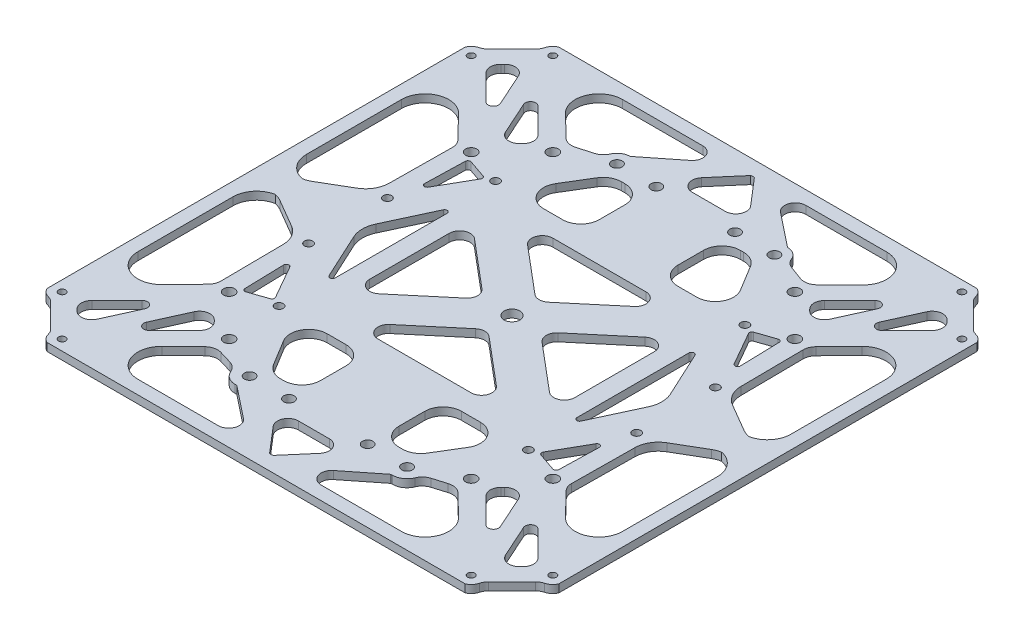
from build123d import *

# Parameters (mm, degrees)
SKETCH2_W               = 195
SKETCH2_H               = 195
BOSS_EXTRUDE1_DEPTH     = 3
CUT_EXTRUDE1_DEPTH      = 138.918454168
CUT_EXTRUDE1_DEPTH_BACK = 138.918454168
SKETCH3_R               = 1.6
CUT_EXTRUDE2_DEPTH      = 138.918454168
CUT_EXTRUDE2_DEPTH_BACK = 138.918454168
SKETCH4_R               = 2.11
SKETCH4_R_2             = 1.35
CUT_EXTRUDE3_DEPTH      = 138.918454168
CUT_EXTRUDE3_DEPTH_BACK = 138.918454168
SKETCH5_R               = 2
CUT_EXTRUDE4_DEPTH      = 138.918454168
CUT_EXTRUDE4_DEPTH_BACK = 138.918454168
SKETCH6_R               = 1.6
CUT_EXTRUDE5_DEPTH      = 138.918454168
CUT_EXTRUDE5_DEPTH_BACK = 138.918454168
CUT_EXTRUDE7_DEPTH      = 138.918454168
CUT_EXTRUDE7_DEPTH_BACK = 138.918454168
SKETCH8_R               = 3
SKETCH9_W               = 5.16198808
SKETCH9_H               = 152.468237428
BOSS_EXTRUDE2_DEPTH     = 3
FILLET1_R               = 9
BOSS_EXTRUDE3_DEPTH     = 3
FILLET2_R               = 9
FILLET3_R               = 4
BOSS_EXTRUDE4_DEPTH     = 3


with BuildPart() as part:
    # Sketch2 → Boss-Extrude1 (new body)
    with BuildSketch(Plane(origin=(0, 0, 0), x_dir=(1, 0, 0), z_dir=(0, 1, 0))):
        Rectangle(SKETCH2_W, SKETCH2_H)
    extrude(amount=BOSS_EXTRUDE1_DEPTH)

    # Sketch3 → Cut-Extrude1 (cut, two sides: drawn at the far end of the back side and taken through both)
    with BuildSketch(Plane(origin=(0, 3, 0), x_dir=(1, 0, 0), z_dir=(0, 1, 0)).offset(-CUT_EXTRUDE1_DEPTH_BACK)):
        with Locations(Location((47.5, 41.25, 0), (0, 0, 270))):
            Circle(SKETCH3_R)
        with Locations(Location((47.5, -41.25, 0), (0, 0, 90))):
            Circle(SKETCH3_R)
        with Locations(Location((-47.5, -41.25, 0), (0, 0, 270))):
            Circle(SKETCH3_R)
        with Locations(Location((-47.5, 41.25, 0), (0, 0, 90))):
            Circle(SKETCH3_R)
    extrude(amount=CUT_EXTRUDE1_DEPTH + CUT_EXTRUDE1_DEPTH_BACK, mode=Mode.SUBTRACT)

    # Sketch4 → Cut-Extrude2 (cut, two sides: drawn at the far end of the back side and taken through both)
    with BuildSketch(Plane(origin=(0, 3, 0), x_dir=(1, 0, 0), z_dir=(0, 1, 0)).offset(-CUT_EXTRUDE2_DEPTH_BACK)):
        with Locations(Location((46.123845661, 61.680194847, 0), (0, 0, 90))):
            Circle(SKETCH4_R)
        with Locations(Location((-61.680194847, 46.123845661, 0), (0, 0, 90))):
            Circle(SKETCH4_R)
        with Locations(Location((-77.943650814, 93.5, 0), (0, 0, 270))):
            Circle(SKETCH4_R_2)
        with Locations(Location((-93.5, 77.943650814, 0), (0, 0, 90))):
            Circle(SKETCH4_R_2)
        with Locations(Location((-46.123845661, 61.680194847, 0), (0, 0, 270))):
            Circle(SKETCH4_R)
        with Locations(Location((93.5, 77.943650814, 0), (0, 0, 270))):
            Circle(SKETCH4_R_2)
        with Locations(Location((77.943650814, 93.5, 0), (0, 0, 90))):
            Circle(SKETCH4_R_2)
        with Locations(Location((61.680194847, 46.123845661, 0), (0, 0, 270))):
            Circle(SKETCH4_R)
        with Locations(Location((61.680194847, -46.123845661, 0), (0, 0, 90))):
            Circle(SKETCH4_R)
        with Locations(Location((77.943650814, -93.5, 0), (0, 0, 270))):
            Circle(SKETCH4_R_2)
        with Locations(Location((93.5, -77.943650814, 0), (0, 0, 90))):
            Circle(SKETCH4_R_2)
        with Locations(Location((-46.123845661, -61.680194847, 0), (0, 0, 90))):
            Circle(SKETCH4_R)
        with Locations(Location((-93.5, -77.943650814, 0), (0, 0, 270))):
            Circle(SKETCH4_R_2)
        with Locations(Location((-77.943650814, -93.5, 0), (0, 0, 90))):
            Circle(SKETCH4_R_2)
        with Locations(Location((-61.680194847, -46.123845661, 0), (0, 0, 270))):
            Circle(SKETCH4_R)
        with Locations(Location((46.123845661, -61.680194847, 0), (0, 0, 270))):
            Circle(SKETCH4_R)
    extrude(amount=CUT_EXTRUDE2_DEPTH + CUT_EXTRUDE2_DEPTH_BACK, mode=Mode.SUBTRACT)

    # Sketch5 → Cut-Extrude3 (cut, two sides: drawn at the far end of the back side and taken through both)
    with BuildSketch(Plane(origin=(0, 3, 0), x_dir=(1, 0, 0), z_dir=(0, 1, 0)).offset(-CUT_EXTRUDE3_DEPTH_BACK)):
        with Locations(Location((30, 70, 0), (0, 0, 270))):
            Circle(SKETCH5_R)
        with Locations(Location((15, 70, 0), (0, 0, 270))):
            Circle(SKETCH5_R)
        with Locations(Location((-15, 70, 0), (0, 0, 90))):
            Circle(SKETCH5_R)
        with Locations(Location((-30, 70, 0), (0, 0, 90))):
            Circle(SKETCH5_R)
        with Locations(Location((-30, -70, 0), (0, 0, 270))):
            Circle(SKETCH5_R)
        with Locations(Location((-15, -70, 0), (0, 0, 270))):
            Circle(SKETCH5_R)
        with Locations(Location((15, -70, 0), (0, 0, 90))):
            Circle(SKETCH5_R)
        with Locations(Location((30, -70, 0), (0, 0, 90))):
            Circle(SKETCH5_R)
    extrude(amount=CUT_EXTRUDE3_DEPTH + CUT_EXTRUDE3_DEPTH_BACK, mode=Mode.SUBTRACT)

    # Sketch6 → Cut-Extrude4 (cut, two sides: drawn at the far end of the back side and taken through both)
    with BuildSketch(Plane(origin=(0, 3, 0), x_dir=(1, 0, 0), z_dir=(0, 1, 0)).offset(-CUT_EXTRUDE4_DEPTH_BACK)):
        with Locations(Location((-62.5, 15, 0), (0, 0, 270))):
            Circle(SKETCH6_R)
        with Locations(Location((-62.5, -15, 0), (0, 0, 90))):
            Circle(SKETCH6_R)
        with Locations(Location((62.5, -15, 0), (0, 0, 270))):
            Circle(SKETCH6_R)
        with Locations(Location((62.5, 15, 0), (0, 0, 90))):
            Circle(SKETCH6_R)
    extrude(amount=CUT_EXTRUDE4_DEPTH + CUT_EXTRUDE4_DEPTH_BACK, mode=Mode.SUBTRACT)

    # Sketch7 → Cut-Extrude5 (cut, two sides: drawn at the far end of the back side and taken through both)
    with BuildSketch(Plane(origin=(0, 3, 0), x_dir=(1, 0, 0), z_dir=(0, 1, 0)).offset(-CUT_EXTRUDE5_DEPTH_BACK)):
        with BuildLine():
            Line((-67.1, -15), (-67.099088544, 15.091567253))
            Line((-67.099088544, 15.091567253), (-66.810690491, 44.064798997))
            ThreePointArc((-66.810690491, 44.064798997), (-67.168435752, 45.972460378), (-68.225667159, 47.60016286))
            Line((-68.225667159, 47.60016286), (-92.33801192, 72.39859956))
            ThreePointArc((-92.33801192, 72.39859956), (-93.391805503, 73.22509409), (-94.627179243, 73.742226418))
            ThreePointArc((-94.627179243, 73.742226418), (-96.350328674, 74.657600533), (-97.5, 76.234118714))
            Line((-97.5, 76.234118714), (-97.5, -76.234118714))
            ThreePointArc((-97.5, -76.234118714), (-96.350328674, -74.657600533), (-94.627179243, -73.742226418))
            ThreePointArc((-94.627179243, -73.742226418), (-93.391805503, -73.22509409), (-92.33801192, -72.39859956))
            Line((-92.33801192, -72.39859956), (-68.225667159, -47.60016286))
            ThreePointArc((-68.225667159, -47.60016286), (-67.168435752, -45.972460378), (-66.810690491, -44.064798997))
            Line((-66.810690491, -44.064798997), (-67.099088544, -15.091567253))
            ThreePointArc((-67.099088544, -15.091567253), (-67.09977213, -15.045785894), (-67.1, -15))
        make_face()
        with BuildLine():
            ThreePointArc((-97.5, 79.653182914), (-96.342305944, 81.236642906), (-94.606672429, 82.150523302))
            ThreePointArc((-94.606672429, 82.150523302), (-93.388598506, 82.650187636), (-92.343175799, 83.450475015))
            Line((-92.343175799, 83.450475015), (-83.450475015, 92.343175799))
            ThreePointArc((-83.450475015, 92.343175799), (-82.650187636, 93.388598506), (-82.150523302, 94.606672429))
            ThreePointArc((-82.150523302, 94.606672429), (-81.236642906, 96.342305944), (-79.653182914, 97.5))
            Line((-79.653182914, 97.5), (-97.5, 97.5))
            Line((-97.5, 97.5), (-97.5, 79.653182914))
        make_face()
        with BuildLine():
            ThreePointArc((-94.606672429, -82.150523302), (-96.342305944, -81.236642906), (-97.5, -79.653182914))
            Line((-97.5, -79.653182914), (-97.5, -97.5))
            Line((-97.5, -97.5), (-79.653182914, -97.5))
            ThreePointArc((-79.653182914, -97.5), (-81.236642906, -96.342305944), (-82.150523302, -94.606672429))
            ThreePointArc((-82.150523302, -94.606672429), (-82.650187636, -93.388598506), (-83.450475015, -92.343175799))
            Line((-83.450475015, -92.343175799), (-92.343175799, -83.450475015))
            ThreePointArc((-92.343175799, -83.450475015), (-93.388598506, -82.650187636), (-94.606672429, -82.150523302))
        make_face()
        with BuildLine():
            Line((76.234118714, 97.5), (-76.234118714, 97.5))
            ThreePointArc((-76.234118714, 97.5), (-74.657600533, 96.350328674), (-73.742226418, 94.627179243))
            ThreePointArc((-73.742226418, 94.627179243), (-73.22509409, 93.391805503), (-72.39859956, 92.33801192))
            Line((-72.39859956, 92.33801192), (-48.235759925, 68.843679325))
            ThreePointArc((-48.235759925, 68.843679325), (-45.974176774, 67.580590379), (-43.384060973, 67.618697772))
            Line((-43.384060973, 67.618697772), (-37.791679223, 69.207086879))
            ThreePointArc((-37.791679223, 69.207086879), (-35.871810562, 70.248237651), (-34.578890795, 72.008422039))
            ThreePointArc((-34.578890795, 72.008422039), (-32.734765968, 74.185815942), (-30, 75))
            Line((-30, 75), (30, 75))
            ThreePointArc((30, 75), (32.793489967, 74.146855894), (34.633680134, 71.878565521))
            ThreePointArc((34.633680134, 71.878565521), (35.789643426, 70.16471047), (37.540094628, 69.064951015))
            Line((37.540094628, 69.064951015), (42.799329414, 67.128943555))
            ThreePointArc((42.799329414, 67.128943555), (45.584611872, 66.93434546), (48.039976467, 68.263575121))
            Line((48.039976467, 68.263575121), (72.419857752, 92.340779607))
            ThreePointArc((72.419857752, 92.340779607), (73.231780338, 93.389992898), (73.739189962, 94.615799689))
            ThreePointArc((73.739189962, 94.615799689), (74.653744886, 96.345877542), (76.234118714, 97.5))
        make_face()
        with BuildLine():
            ThreePointArc((-73.742226418, -94.627179243), (-74.657600533, -96.350328674), (-76.234118714, -97.5))
            Line((-76.234118714, -97.5), (76.234118714, -97.5))
            ThreePointArc((76.234118714, -97.5), (74.657600533, -96.350328674), (73.742226418, -94.627179243))
            ThreePointArc((73.742226418, -94.627179243), (73.22509409, -93.391805503), (72.39859956, -92.33801192))
            Line((72.39859956, -92.33801192), (48.235759925, -68.843679325))
            ThreePointArc((48.235759925, -68.843679325), (45.933721874, -67.570555303), (43.304064218, -67.642141429))
            Line((43.304064218, -67.642141429), (38.28462916, -69.158674052))
            ThreePointArc((38.28462916, -69.158674052), (36.361057884, -70.251030176), (35.097048147, -72.066422073))
            ThreePointArc((35.097048147, -72.066422073), (33.072838964, -74.561541483), (30, -75.5))
            Line((30, -75.5), (-30, -75.5))
            ThreePointArc((-30, -75.5), (-33.072838964, -74.561541483), (-35.097048147, -72.066422073))
            ThreePointArc((-35.097048147, -72.066422073), (-36.361057884, -70.251030176), (-38.28462916, -69.158674052))
            Line((-38.28462916, -69.158674052), (-43.304064218, -67.642141429))
            ThreePointArc((-43.304064218, -67.642141429), (-45.933721874, -67.570555303), (-48.235759925, -68.843679325))
            Line((-48.235759925, -68.843679325), (-72.39859956, -92.33801192))
            ThreePointArc((-72.39859956, -92.33801192), (-73.22509409, -93.391805503), (-73.742226418, -94.627179243))
        make_face()
        with BuildLine():
            Line((97.5, 97.5), (79.653182914, 97.5))
            ThreePointArc((79.653182914, 97.5), (81.236642906, 96.342305944), (82.150523302, 94.606672429))
            ThreePointArc((82.150523302, 94.606672429), (82.650187636, 93.388598506), (83.450475015, 92.343175799))
            Line((83.450475015, 92.343175799), (92.343175799, 83.450475015))
            ThreePointArc((92.343175799, 83.450475015), (93.388598506, 82.650187636), (94.606672429, 82.150523302))
            ThreePointArc((94.606672429, 82.150523302), (96.342305944, 81.236642906), (97.5, 79.653182914))
            Line((97.5, 79.653182914), (97.5, 97.5))
        make_face()
        with BuildLine():
            ThreePointArc((82.150523302, -94.606672429), (81.236642906, -96.342305944), (79.653182914, -97.5))
            Line((79.653182914, -97.5), (97.5, -97.5))
            Line((97.5, -97.5), (97.5, -79.653182914))
            ThreePointArc((97.5, -79.653182914), (96.342305944, -81.236642906), (94.606672429, -82.150523302))
            ThreePointArc((94.606672429, -82.150523302), (93.388598506, -82.650187636), (92.343175799, -83.450475015))
            Line((92.343175799, -83.450475015), (83.450475015, -92.343175799))
            ThreePointArc((83.450475015, -92.343175799), (82.650187636, -93.388598506), (82.150523302, -94.606672429))
        make_face()
        with BuildLine():
            ThreePointArc((94.627179243, -73.742226418), (96.350328674, -74.657600533), (97.5, -76.234118714))
            Line((97.5, -76.234118714), (97.5, 76.234118714))
            ThreePointArc((97.5, 76.234118714), (96.350328674, 74.657600533), (94.627179243, 73.742226418))
            ThreePointArc((94.627179243, 73.742226418), (93.391805503, 73.22509409), (92.33801192, 72.39859956))
            Line((92.33801192, 72.39859956), (68.225667159, 47.60016286))
            ThreePointArc((68.225667159, 47.60016286), (67.168435752, 45.972460378), (66.810690491, 44.064798997))
            Line((66.810690491, 44.064798997), (67.099088544, 15.091567253))
            ThreePointArc((67.099088544, 15.091567253), (67.09977213, 15.045785894), (67.1, 15))
            Line((67.1, 15), (67.099088544, -15.091567253))
            Line((67.099088544, -15.091567253), (66.810690491, -44.064798997))
            ThreePointArc((66.810690491, -44.064798997), (67.168435752, -45.972460378), (68.225667159, -47.60016286))
            Line((68.225667159, -47.60016286), (92.33801192, -72.39859956))
            ThreePointArc((92.33801192, -72.39859956), (93.391805503, -73.22509409), (94.627179243, -73.742226418))
        make_face()
    extrude(amount=CUT_EXTRUDE5_DEPTH + CUT_EXTRUDE5_DEPTH_BACK, mode=Mode.SUBTRACT)

    # Sketch8 → Cut-Extrude7 (cut, two sides: drawn at the far end of the back side and taken through both)
    with BuildSketch(Plane(origin=(0, 3, 0), x_dir=(1, 0, 0), z_dir=(0, 1, 0)).offset(-CUT_EXTRUDE7_DEPTH_BACK)):
        with Locations(Location((0, 0, 0), (0, 0, 270))):
            Circle(SKETCH8_R)
        with BuildLine():
            Line((-46.075946512, -21.34896745), (-46.075946512, 21.363521254))
            ThreePointArc((-46.075946512, 21.363521254), (-46.860319172, 22.339996984), (-47.982956213, 21.784630983))
            Line((-47.982956213, 21.784630983), (-56.124255266, 4.249445458))
            ThreePointArc((-56.124255266, 4.249445458), (-57.054155987, 0.045094312), (-56.129928738, -4.160507655))
            Line((-56.129928738, -4.160507655), (-47.98352356, -21.768853033))
            ThreePointArc((-47.98352356, -21.768853033), (-46.860977965, -22.325588422), (-46.075946512, -21.34896745))
        make_face()
        with BuildLine():
            Line((56.124255266, 4.249445458), (47.982956213, 21.784630983))
            ThreePointArc((47.982956213, 21.784630983), (46.860319172, 22.339996984), (46.075946512, 21.363521254))
            Line((46.075946512, 21.363521254), (46.075946512, -21.34896745))
            ThreePointArc((46.075946512, -21.34896745), (46.860977965, -22.325588422), (47.98352356, -21.768853033))
            Line((47.98352356, -21.768853033), (56.129928738, -4.160507655))
            ThreePointArc((56.129928738, -4.160507655), (57.054155987, 0.045094312), (56.124255266, 4.249445458))
        make_face()
        with BuildLine():
            Line((-58.318731361, 26.348348992), (-51.034926184, 39.095008052))
            ThreePointArc((-51.034926184, 39.095008052), (-50.967376772, 39.943698114), (-51.578125125, 40.536845815))
            Line((-51.578125125, 40.536845815), (-58.463843567, 42.903521965))
            ThreePointArc((-58.463843567, 42.903521965), (-59.359048857, 42.779356057), (-59.788541049, 41.984154106))
            Line((-59.788541049, 41.984154106), (-60.186627783, 26.870818896))
            ThreePointArc((-60.186627783, 26.870818896), (-59.456345727, 25.881451512), (-58.318731361, 26.348348992))
        make_face()
        with BuildLine():
            Line((-59.788541049, -41.984154106), (-60.186627783, -26.870818896))
            ThreePointArc((-60.186627783, -26.870818896), (-59.456345727, -25.881451512), (-58.318731361, -26.348348992))
            Line((-58.318731361, -26.348348992), (-51.034926184, -39.095008052))
            ThreePointArc((-51.034926184, -39.095008052), (-50.967376772, -39.943698114), (-51.578125125, -40.536845815))
            Line((-51.578125125, -40.536845815), (-58.463843567, -42.903521965))
            ThreePointArc((-58.463843567, -42.903521965), (-59.359048857, -42.779356057), (-59.788541049, -41.984154106))
        make_face()
        with BuildLine():
            Line((59.788541049, 41.984154106), (60.186627783, 26.870818896))
            ThreePointArc((60.186627783, 26.870818896), (59.456345727, 25.881451512), (58.318731361, 26.348348992))
            Line((58.318731361, 26.348348992), (51.034926184, 39.095008052))
            ThreePointArc((51.034926184, 39.095008052), (50.967376772, 39.943698114), (51.578125125, 40.536845815))
            Line((51.578125125, 40.536845815), (58.463843567, 42.903521965))
            ThreePointArc((58.463843567, 42.903521965), (59.359048857, 42.779356057), (59.788541049, 41.984154106))
        make_face()
        with BuildLine():
            Line((58.318731361, -26.348348992), (51.034926184, -39.095008052))
            ThreePointArc((51.034926184, -39.095008052), (50.967376772, -39.943698114), (51.578125125, -40.536845815))
            Line((51.578125125, -40.536845815), (58.463843567, -42.903521965))
            ThreePointArc((58.463843567, -42.903521965), (59.359048857, -42.779356057), (59.788541049, -41.984154106))
            Line((59.788541049, -41.984154106), (60.186627783, -26.870818896))
            ThreePointArc((60.186627783, -26.870818896), (59.456345727, -25.881451512), (58.318731361, -26.348348992))
        make_face()
        with BuildLine():
            Line((-29.190874416, -41.25), (-22, -41.25))
            ThreePointArc((-22, -41.25), (-17.050252532, -43.300252532), (-15, -48.25))
            Line((-15, -48.25), (-15, -58))
            ThreePointArc((-15, -58), (-17.050252532, -62.949747468), (-22, -65))
            Line((-22, -65), (-23.256091807, -65))
            ThreePointArc((-23.256091807, -65), (-26.685566957, -64.102352022), (-29.235481697, -61.639628628))
            Line((-29.235481697, -61.639628628), (-35.170264305, -51.889628628))
            ThreePointArc((-35.170264305, -51.889628628), (-35.293226438, -44.82052485), (-29.190874416, -41.25))
        make_face()
        with BuildLine():
            Line((29.190874416, 41.25), (22, 41.25))
            ThreePointArc((22, 41.25), (17.050252532, 43.300252532), (15, 48.25))
            Line((15, 48.25), (15, 58))
            ThreePointArc((15, 58), (17.050252532, 62.949747468), (22, 65))
            Line((22, 65), (23.256091807, 65))
            ThreePointArc((23.256091807, 65), (26.685566957, 64.102352022), (29.235481697, 61.639628628))
            Line((29.235481697, 61.639628628), (35.170264305, 51.889628628))
            ThreePointArc((35.170264305, 51.889628628), (35.293226438, 44.82052485), (29.190874416, 41.25))
        make_face()
        with BuildLine():
            Line((29.235481697, -61.639628628), (35.170264305, -51.889628628))
            ThreePointArc((35.170264305, -51.889628628), (35.293226438, -44.82052485), (29.190874416, -41.25))
            Line((29.190874416, -41.25), (22, -41.25))
            ThreePointArc((22, -41.25), (17.050252532, -43.300252532), (15, -48.25))
            Line((15, -48.25), (15, -58))
            ThreePointArc((15, -58), (17.050252532, -62.949747468), (22, -65))
            Line((22, -65), (23.256091807, -65))
            ThreePointArc((23.256091807, -65), (26.685566957, -64.102352022), (29.235481697, -61.639628628))
        make_face()
        with BuildLine():
            Line((-29.235481697, 61.639628628), (-35.170264305, 51.889628628))
            ThreePointArc((-35.170264305, 51.889628628), (-35.293226438, 44.82052485), (-29.190874416, 41.25))
            Line((-29.190874416, 41.25), (-22, 41.25))
            ThreePointArc((-22, 41.25), (-17.050252532, 43.300252532), (-15, 48.25))
            Line((-15, 48.25), (-15, 58))
            ThreePointArc((-15, 58), (-17.050252532, 62.949747468), (-22, 65))
            Line((-22, 65), (-23.256091807, 65))
            ThreePointArc((-23.256091807, 65), (-26.685566957, 64.102352022), (-29.235481697, 61.639628628))
        make_face()
        with BuildLine():
            Line((-55.317751874, 58.143142882), (-54.609127035, 58.851767722))
            ThreePointArc((-54.609127035, 58.851767722), (-53.437554159, 61.680194847), (-54.609127035, 64.508621971))
            Line((-54.609127035, 64.508621971), (-64.215657306, 74.115152242))
            ThreePointArc((-64.215657306, 74.115152242), (-66.766627573, 74.346473303), (-67.453044382, 71.878723174))
            Line((-67.453044382, 71.878723174), (-61.792526027, 59.327138995))
            ThreePointArc((-61.792526027, 59.327138995), (-58.865699631, 57.036815878), (-55.317751874, 58.143142882))
        make_face()
        with BuildLine():
            Line((-84.306093786, 81.480702778), (-85.014718626, 80.772077939))
            ThreePointArc((-85.014718626, 80.772077939), (-86.186291501, 77.943650814), (-85.014718626, 75.115223689))
            Line((-85.014718626, 75.115223689), (-75.408188355, 65.508693418))
            ThreePointArc((-75.408188355, 65.508693418), (-72.857218088, 65.277372358), (-72.170801279, 67.745122487))
            Line((-72.170801279, 67.745122487), (-77.831319634, 80.296706666))
            ThreePointArc((-77.831319634, 80.296706666), (-80.758146029, 82.587029783), (-84.306093786, 81.480702778))
        make_face()
        with BuildLine():
            Line((55.317751874, -58.143142882), (54.609127035, -58.851767722))
            ThreePointArc((54.609127035, -58.851767722), (53.437554159, -61.680194847), (54.609127035, -64.508621971))
            Line((54.609127035, -64.508621971), (64.215657306, -74.115152242))
            ThreePointArc((64.215657306, -74.115152242), (66.766627573, -74.346473303), (67.453044382, -71.878723174))
            Line((67.453044382, -71.878723174), (61.792526027, -59.327138995))
            ThreePointArc((61.792526027, -59.327138995), (58.865699631, -57.036815878), (55.317751874, -58.143142882))
        make_face()
        with BuildLine():
            Line((-32.5, -18.207707646), (-14.5051535, -3.060146984))
            ThreePointArc((-14.5051535, -3.060146984), (-13.081100012, 0), (-14.5051535, 3.060146984))
            Line((-14.5051535, 3.060146984), (-32.5, 18.207707646))
            ThreePointArc((-32.5, 18.207707646), (-36.763580055, 18.774114539), (-39.075946512, 15.147560662))
            Line((-39.075946512, 15.147560662), (-39.075946512, -15.147560662))
            ThreePointArc((-39.075946512, -15.147560662), (-36.763580055, -18.774114539), (-32.5, -18.207707646))
        make_face()
        with BuildLine():
            Line((67.453044382, 71.878723174), (61.792526027, 59.327138995))
            ThreePointArc((61.792526027, 59.327138995), (58.865699631, 57.036815878), (55.317751874, 58.143142882))
            Line((55.317751874, 58.143142882), (54.609127035, 58.851767722))
            ThreePointArc((54.609127035, 58.851767722), (53.437554159, 61.680194847), (54.609127035, 64.508621971))
            Line((54.609127035, 64.508621971), (64.215657306, 74.115152242))
            ThreePointArc((64.215657306, 74.115152242), (66.766627573, 74.346473303), (67.453044382, 71.878723174))
        make_face()
        with BuildLine():
            Line((77.831319634, 80.296706666), (72.170801279, 67.745122487))
            ThreePointArc((72.170801279, 67.745122487), (72.857218088, 65.277372358), (75.408188355, 65.508693418))
            Line((75.408188355, 65.508693418), (85.014718626, 75.115223689))
            ThreePointArc((85.014718626, 75.115223689), (86.186291501, 77.943650814), (85.014718626, 80.772077939))
            Line((85.014718626, 80.772077939), (84.306093786, 81.480702778))
            ThreePointArc((84.306093786, 81.480702778), (80.758146029, 82.587029783), (77.831319634, 80.296706666))
        make_face()
        with BuildLine():
            Line((84.306093786, -81.480702778), (85.014718626, -80.772077939))
            ThreePointArc((85.014718626, -80.772077939), (86.186291501, -77.943650814), (85.014718626, -75.115223689))
            Line((85.014718626, -75.115223689), (75.408188355, -65.508693418))
            ThreePointArc((75.408188355, -65.508693418), (72.857218088, -65.277372358), (72.170801279, -67.745122487))
            Line((72.170801279, -67.745122487), (77.831319634, -80.296706666))
            ThreePointArc((77.831319634, -80.296706666), (80.758146029, -82.587029783), (84.306093786, -81.480702778))
        make_face()
        with BuildLine():
            Line((-67.453044382, -71.878723174), (-61.792526027, -59.327138995))
            ThreePointArc((-61.792526027, -59.327138995), (-58.865699631, -57.036815878), (-55.317751874, -58.143142882))
            Line((-55.317751874, -58.143142882), (-54.609127035, -58.851767722))
            ThreePointArc((-54.609127035, -58.851767722), (-53.437554159, -61.680194847), (-54.609127035, -64.508621971))
            Line((-54.609127035, -64.508621971), (-64.215657306, -74.115152242))
            ThreePointArc((-64.215657306, -74.115152242), (-66.766627573, -74.346473303), (-67.453044382, -71.878723174))
        make_face()
        with BuildLine():
            Line((-77.831319634, -80.296706666), (-72.170801279, -67.745122487))
            ThreePointArc((-72.170801279, -67.745122487), (-72.857218088, -65.277372358), (-75.408188355, -65.508693418))
            Line((-75.408188355, -65.508693418), (-85.014718626, -75.115223689))
            ThreePointArc((-85.014718626, -75.115223689), (-86.186291501, -77.943650814), (-85.014718626, -80.772077939))
            Line((-85.014718626, -80.772077939), (-84.306093786, -81.480702778))
            ThreePointArc((-84.306093786, -81.480702778), (-80.758146029, -82.587029783), (-77.831319634, -80.296706666))
        make_face()
        with BuildLine():
            Line((-20.31441961, 26.25), (-2.575946512, 11.318247329))
            ThreePointArc((-2.575946512, 11.318247329), (0, 10.378394314), (2.575946512, 11.318247329))
            Line((2.575946512, 11.318247329), (20.31441961, 26.25))
            ThreePointArc((20.31441961, 26.25), (21.496171059, 30.681170701), (17.738473098, 33.310146984))
            Line((17.738473098, 33.310146984), (-17.738473098, 33.310146984))
            ThreePointArc((-17.738473098, 33.310146984), (-21.496171059, 30.681170701), (-20.31441961, 26.25))
        make_face()
        with BuildLine():
            Line((32.5, -18.207707646), (14.5051535, -3.060146984))
            ThreePointArc((14.5051535, -3.060146984), (13.081100012, 0), (14.5051535, 3.060146984))
            Line((14.5051535, 3.060146984), (32.5, 18.207707646))
            ThreePointArc((32.5, 18.207707646), (36.763580055, 18.774114539), (39.075946512, 15.147560662))
            Line((39.075946512, 15.147560662), (39.075946512, -15.147560662))
            ThreePointArc((39.075946512, -15.147560662), (36.763580055, -18.774114539), (32.5, -18.207707646))
        make_face()
        with BuildLine():
            Line((17.738473098, -33.310146984), (-17.738473098, -33.310146984))
            ThreePointArc((-17.738473098, -33.310146984), (-21.496171059, -30.681170701), (-20.31441961, -26.25))
            Line((-20.31441961, -26.25), (-2.575946512, -11.318247329))
            ThreePointArc((-2.575946512, -11.318247329), (0, -10.378394314), (2.575946512, -11.318247329))
            Line((2.575946512, -11.318247329), (20.31441961, -26.25))
            ThreePointArc((20.31441961, -26.25), (21.496171059, -30.681170701), (17.738473098, -33.310146984))
        make_face()
    extrude(amount=CUT_EXTRUDE7_DEPTH + CUT_EXTRUDE7_DEPTH_BACK, mode=Mode.SUBTRACT)

    # Sketch9 → Boss-Extrude2 (add)
    with BuildSketch(Plane(origin=(0, 0, 0), x_dir=(1, 0, 0), z_dir=(0, 1, 0))):
        Polygon((-76.234118714, 97.5), (76.234118714, 97.5), (75.78009356, 92.33801192), (-72.39859956, 92.33801192), (-74.953859457, 93.391805503), align=None)
        with Locations((-94.91900596, 0)):
            Rectangle(SKETCH9_W, SKETCH9_H)
        with Locations((94.91900596, 0)):
            Rectangle(SKETCH9_W, SKETCH9_H)
        Polygon((-74.953859457, -93.391805503), (-72.39859956, -92.33801192), (72.39859956, -92.33801192), (75.78009356, -93.391805503), (76.234118714, -97.5), (-76.234118714, -97.5), align=None)
    extrude(amount=BOSS_EXTRUDE2_DEPTH)

    # Fillet1
    fillet1_edges = [part.edges().sort_by_distance(p)[0] for p in [
        (72.417055273, 1.5, -92.33801192),
        (92.33801192, 1.5, -72.39859956),
        (-72.39859956, 1.5, -92.33801192),
        (-92.33801192, 1.5, -72.39859956),
        (-92.33801192, 1.5, 72.39859956),
        (-72.39859956, 1.5, 92.33801192),
        (72.39859956, 1.5, 92.33801192),
        (92.33801192, 1.5, 72.39859956),
    ]]
    fillet(fillet1_edges, radius=FILLET1_R)

    # Sketch10 → Boss-Extrude3 (add)
    with BuildSketch(Plane.XZ):
        Polygon((15, -75), (0.131749864, -92.33801192), (8.131749864, -92.33801192), (30, -75), align=None)
        Polygon((-30, -75), (-8.131749864, -92.33801192), (-0.131749864, -92.33801192), (-15, -75), align=None)
        Polygon((-15, 75), (-0.131749864, 92.33801192), (-8.131749864, 92.33801192), (-30, 75), align=None)
        Polygon((30, 75), (8.131749864, 92.33801192), (0.131749864, 92.33801192), (15, 75), align=None)
        Polygon((-92.33801192, 5), (-92.33801192, -5), (-84.33801192, -5), (-67.099088544, -15.091567253), (-67.099088544, 15.091567253), (-84.33801192, 5), align=None)
        Polygon((92.33801192, -5), (92.33801192, 5), (84.33801192, 5), (67.099088544, 15.091567253), (67.099088544, -15.091567253), (84.33801192, -5), align=None)
    extrude(amount=-BOSS_EXTRUDE3_DEPTH)

    # Fillet2
    # the kernel refuses this fillet: 9 mm, written as the material it adds along each edge
    with BuildSketch(Plane(origin=(84.33801192, 0, 5), x_dir=(-0.8630037712429959, 0, 0.5051974770526539), z_dir=(0, 1, 0)), Plane(origin=(-84.33801192, 0, -5), x_dir=(0.8630037712431916, 0, -0.5051974770523198), z_dir=(0, 1, 0))) as fillet2_piece_1:
        with BuildLine():
            CenterArc((FILLET2_R * 0.271173620178, FILLET2_R), FILLET2_R, 239.655537794, 30.344462206)
            Line((-FILLET2_R * 0.234023856875, FILLET2_R * 0.136996228757), (0, 0))
            Line((0, 0), (FILLET2_R * 0.271173620178, 0))
        make_face()
    extrude(amount=3)
    with BuildSketch(Plane(origin=(92.33801192, 0, 5), x_dir=(0, 0, 1), z_dir=(0, 1, 0)), Plane(origin=(-92.33801192, 0, -5), x_dir=(0, 0, -1), z_dir=(0, 1, 0))) as fillet2_piece_2:
        with BuildLine():
            CenterArc((FILLET2_R, -FILLET2_R), FILLET2_R, 90, 90)
            Line((0, -FILLET2_R), (0, 0))
            Line((0, 0), (FILLET2_R, 0))
        make_face()
    extrude(amount=3)
    with BuildSketch(Plane(origin=(67.099088544, 0, 15.091567253), x_dir=(-0.009953455302394536, 0, 0.9999504631368212), z_dir=(0, 1, 0)), Plane(origin=(67.099088544, 3, -15.091567253), x_dir=(-0.00995345530239279, 0, -0.9999504631368212), z_dir=(0, -1, 0)), Plane(origin=(-67.099088544, 0, -15.091567253), x_dir=(0.009953455302392689, 0, -0.9999504631368212), z_dir=(0, 1, 0))) as fillet2_piece_3:
        with BuildLine():
            CenterArc((FILLET2_R * 0.566755129621, FILLET2_R), FILLET2_R, 210.914762604, 59.085237396)
            Line((-FILLET2_R * 0.291177430616, FILLET2_R * 0.486237679383), (0, 0))
            Line((0, 0), (FILLET2_R * 0.566755129621, 0))
        make_face()
    extrude(amount=3)
    with BuildSketch(Plane(origin=(84.33801192, 0, -5), x_dir=(-0.8630037712431937, 0, -0.5051974770523161), z_dir=(0, 1, 0)), Plane(origin=(-84.33801192, 0, 5), x_dir=(0.8630037712429962, 0, 0.5051974770526534), z_dir=(0, 1, 0))) as fillet2_piece_4:
        with BuildLine():
            CenterArc((FILLET2_R * 0.271173620177, -FILLET2_R), FILLET2_R, 90, 30.344462206)
            Line((-FILLET2_R * 0.234023856875, -FILLET2_R * 0.136996228757), (0, 0))
            Line((0, 0), (FILLET2_R * 0.271173620177, 0))
        make_face()
    extrude(amount=3)
    with BuildSketch(Plane(origin=(92.33801192, 0, -5), x_dir=(0, 0, -1), z_dir=(0, 1, 0)), Plane(origin=(-92.33801192, 0, 5), x_dir=(0, 0, 1), z_dir=(0, 1, 0))) as fillet2_piece_5:
        with BuildLine():
            CenterArc((FILLET2_R, FILLET2_R), FILLET2_R, 180, 90)
            Line((0, FILLET2_R), (0, 0))
            Line((0, 0), (FILLET2_R, 0))
        make_face()
    extrude(amount=3)
    with BuildSketch(Plane(origin=(-67.099088544, 0, 15.091567253), x_dir=(0.009953455302383283, 0, 0.9999504631368213), z_dir=(0, 1, 0))) as fillet2_piece_6:
        with BuildLine():
            CenterArc((FILLET2_R * 0.566755129621, -FILLET2_R), FILLET2_R, 90, 59.085237396)
            Line((-FILLET2_R * 0.291177430616, -FILLET2_R * 0.486237679383), (0, 0))
            Line((0, 0), (FILLET2_R * 0.566755129621, 0))
        make_face()
    extrude(amount=3)

    # Fillet3
    fillet3_edges = [part.edges().sort_by_distance(p)[0] for p in [
        (-14.571223904, 1.5, 75.5),
        (-8.131749864, 1.5, 92.33801192),
        (8.131749864, 1.5, 92.33801192),
        (14.571223904, 1.5, 75.5),
        (15, 1.5, -75),
        (8.131749864, 1.5, -92.33801192),
        (-8.131749864, 1.5, -92.33801192),
        (-15, 1.5, -75),
    ]]
    fillet(fillet3_edges, radius=FILLET3_R)

    # Sketch11 → Boss-Extrude4 (add)
    with BuildSketch(Plane.XZ):
        with BuildLine():
            Line((-1.502465546, 92.33801192), (1.497534454, 92.33801192))
            Line((1.497534454, 92.33801192), (1.497534454, 90.83801192))
            ThreePointArc((1.497534454, 90.83801192), (-0.002465546, 91.809351713), (-1.502465546, 90.83801192))
            Line((-1.502465546, 90.83801192), (-1.502465546, 92.33801192))
        make_face()
        with BuildLine():
            Line((-1.502465546, -92.33801192), (-1.502465546, -90.83801192))
            ThreePointArc((-1.502465546, -90.83801192), (-0.002465546, -91.809351713), (1.497534454, -90.83801192))
            Line((1.497534454, -90.83801192), (1.497534454, -92.33801192))
            Line((1.497534454, -92.33801192), (-1.502465546, -92.33801192))
        make_face()
    extrude(amount=-BOSS_EXTRUDE4_DEPTH)


solid = part.part
